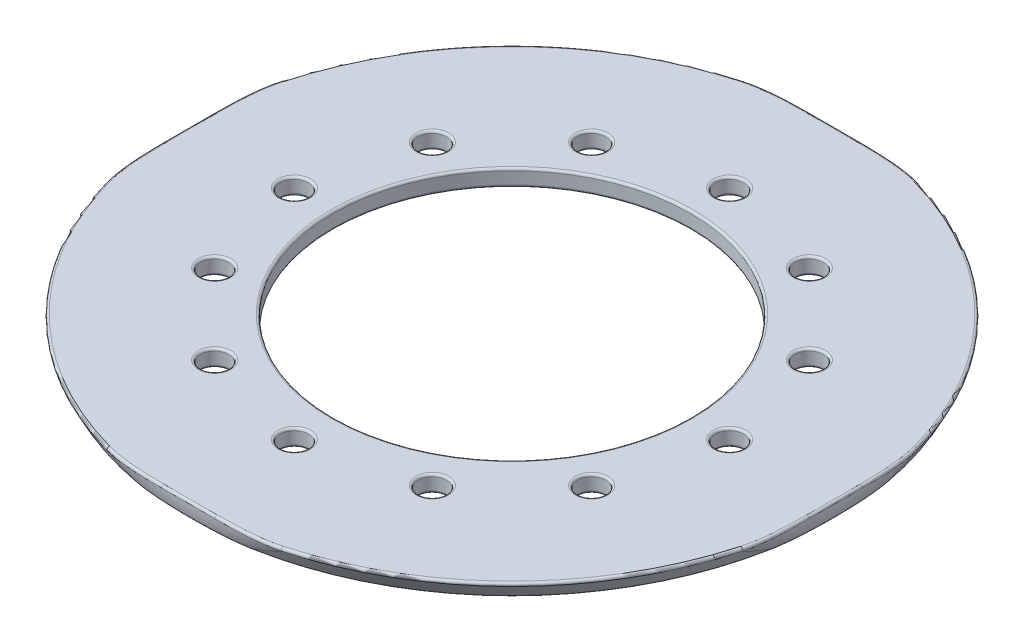
from build123d import *

# Parameters (mm, degrees)
TOP_CUT_DEPTH                    = 152.25
TOP_CUT_DEPTH_BACK               = 50
TOP_CUT_SKETCH_W                 = 443.917863005
TOP_CUT_SKETCH_H                 = 367.972648153
BOLT_HOLE_CUT_SKETCH_R           = 3.15625
BOLT_HOLE_CUT_DEPTH              = 143.297004536
BOLT_HOLE_CIRCULAR_PATTERN_COUNT = 12
SIDE_CUT_SKETCH_W                = 344.016473242
SIDE_CUT_SKETCH_H                = 145.993446884
SIDE_CUT_DEPTH                   = 191.395733114
CENTER_CUT_SKETCH_R              = 40
CENTER_CUT_DEPTH                 = 143.297004574
CIRPATTERN1_COUNT                = 4
BOTTOM_CUT_SKETCH_W              = 195
BOTTOM_CUT_SKETCH_H              = 195
BOTTOM_CUT_DEPTH                 = 32.154348448
FILLET1_R                        = 10
FILLET2_R                        = 0.5


with BuildPart() as part:
    # Main Revolve Sketch → Main Revolve (revolve)
    with BuildSketch(Plane.XY):
        with BuildLine():
            Line((0, 0), (0, 13.75))
            Line((0, 13.75), (0, 96.25))
            ThreePointArc((0, 96.25), (-58.336309448, 72.086309448), (-82.5, 13.75))
            Line((-82.5, 13.75), (-82.5, -13.75))
            ThreePointArc((-82.5, -13.75), (-58.336309448, -72.086309448), (0, -96.25))
            Line((0, -96.25), (0, -13.75))
            Line((0, -13.75), (0, 0))
        make_face()
    revolve(axis=Axis((0, 13.75, 0), (0, 1, 0)))

    # Top Cut Sketch → Top Cut (cut, two sides: drawn at the far end of the back side and taken through both)
    with BuildSketch(Plane(origin=(0, 0, 0), x_dir=(1, 0, 0), z_dir=(0, 1, 0)).offset(-TOP_CUT_DEPTH_BACK)):
        with Locations((35.712333175, -10.849316407)):
            Rectangle(TOP_CUT_SKETCH_W, TOP_CUT_SKETCH_H)
    extrude(amount=TOP_CUT_DEPTH + TOP_CUT_DEPTH_BACK, mode=Mode.SUBTRACT)

    # Bolt Hole Cut Sketch → Bolt Hole Cut (cut, symmetric)
    with BuildSketch(Plane(origin=(0, 0, 0), x_dir=(1, 0, 0), z_dir=(0, 1, 0))):
        with Locations(Location((-48.75, 0, 0), (0, 0, 270))):
            Circle(BOLT_HOLE_CUT_SKETCH_R)
    bolt_hole_cut = extrude(amount=BOLT_HOLE_CUT_DEPTH, both=True, mode=Mode.SUBTRACT)

    # Bolt Hole Circular Pattern: Bolt Hole Cut ×12 about axis
    bolt_hole_circular_pattern_axis = Axis((0, 0, 0), (0, 1, 0))
    for i in range(1, BOLT_HOLE_CIRCULAR_PATTERN_COUNT):
        add(bolt_hole_cut.rotate(bolt_hole_circular_pattern_axis, i * 360 / BOLT_HOLE_CIRCULAR_PATTERN_COUNT), mode=Mode.SUBTRACT)

    # Side Cut Sketch → Side Cut (cut, through all)
    with BuildSketch(Plane.XY.offset(72.5)):
        with Locations((-8.982819182, -61.331760594)):
            Rectangle(SIDE_CUT_SKETCH_W, SIDE_CUT_SKETCH_H)
    side_cut = extrude(amount=SIDE_CUT_DEPTH, mode=Mode.SUBTRACT)

    # Center Cut Sketch → Center Cut (cut, through all)
    with BuildSketch(Plane(origin=(0, 0, 0), x_dir=(1, 0, 0), z_dir=(0, 1, 0))):
        with Locations(Location((0, 0, 0), (0, 0, 270))):
            Circle(CENTER_CUT_SKETCH_R)
    extrude(amount=-CENTER_CUT_DEPTH, mode=Mode.SUBTRACT)

    # CirPattern1: Side Cut ×4 about axis
    cirpattern1_axis = Axis((0, 0, 0), (0, 1, 0))
    for i in range(1, CIRPATTERN1_COUNT):
        add(side_cut.rotate(cirpattern1_axis, i * 360 / CIRPATTERN1_COUNT), mode=Mode.SUBTRACT)

    # Bottom Cut Sketch → Bottom Cut (cut)
    with BuildSketch(Plane(origin=(0, -85.904348448, 0), x_dir=(-1, 0, 0), z_dir=(0, -1, 0))):
        Rectangle(BOTTOM_CUT_SKETCH_W, BOTTOM_CUT_SKETCH_H)
    extrude(amount=-BOTTOM_CUT_DEPTH, mode=Mode.SUBTRACT)

    # Fillet1
    # the kernel refuses this fillet: 10 mm, written as the material it takes off along each edge
    with BuildSketch(Plane(origin=(72.5, -13.75, 0), x_dir=(0, -0.8371149165543559, -0.5470270710688764), z_dir=(0, 0.5470270710688764, -0.8371149165543559))) as fillet1_piece_1:
        with BuildLine():
            CenterArc((36.742346142, 10), FILLET1_R, 270, 30.450314021)
            Line((36.742346142, 0), (39.37003937, 0))
            ThreePointArc((39.37003937, 0), (40.596006103, 0.679290671), (41.810255954, 1.379310345))
        make_face()
    revolve(axis=Axis((72.5, -13.75, 0), (-1, 0, 0)), revolution_arc=66.32659143, mode=Mode.SUBTRACT)
    with BuildSketch(Plane(origin=(-72.5, -13.75, 0), x_dir=(0, -0.8371225543218439, 0.5470153828236199), z_dir=(0, 0.5470153828236199, 0.8371225543218439))) as fillet1_piece_2:
        with BuildLine():
            CenterArc((36.742346142, 10), FILLET1_R, 270, 30.450314021)
            Line((36.742346142, 0), (39.37003937, 0))
            ThreePointArc((39.37003937, 0), (40.596006103, 0.679290671), (41.810255954, 1.379310345))
        make_face()
    revolve(axis=Axis((-72.5, -13.75, 0), (1, 0, 0)), revolution_arc=33.162495725, mode=Mode.SUBTRACT)
    with BuildSketch(Plane(origin=(0, -13.75, -72.5), x_dir=(-0.5470270710688764, -0.8371149165543559, 0), z_dir=(-0.8371149165543559, 0.5470270710688764, 0))) as fillet1_piece_3:
        with BuildLine():
            CenterArc((36.742346142, 10), FILLET1_R, 270, 30.450314021)
            Line((36.742346142, 0), (39.37003937, 0))
            ThreePointArc((39.37003937, 0), (40.596006103, 0.679290671), (41.810255954, 1.379310345))
        make_face()
    revolve(axis=Axis((0, -13.75, -72.5), (0, 0, 1)), revolution_arc=66.32659143, mode=Mode.SUBTRACT)
    with BuildSketch(Plane(origin=(0, -13.75, 72.5), x_dir=(0.5470270710688766, -0.8371149165543559, 0), z_dir=(0.8371149165543559, 0.5470270710688766, 0))) as fillet1_piece_4:
        with BuildLine():
            CenterArc((36.742346142, 10), FILLET1_R, 270, 30.450314021)
            Line((36.742346142, 0), (39.37003937, 0))
            ThreePointArc((39.37003937, 0), (40.596006103, 0.679290671), (41.810255954, 1.379310345))
        make_face()
    revolve(axis=Axis((0, -13.75, 72.5), (0, 0, -1)), revolution_arc=66.32659143, mode=Mode.SUBTRACT)
    with BuildSketch(Plane(origin=(-72.5, -13.75, 0), x_dir=(0, -1, 0), z_dir=(0, 0, 1))) as fillet1_piece_5:
        with BuildLine():
            CenterArc((36.742346142, 10), FILLET1_R, 270, 30.450314021)
            Line((36.742346142, 0), (39.37003937, 0))
            ThreePointArc((39.37003937, 0), (40.596006103, 0.679290671), (41.810255954, 1.379310345))
        make_face()
    revolve(axis=Axis((-72.5, -13.75, 0), (1, 0, 0)), revolution_arc=33.162495725, mode=Mode.SUBTRACT)

    # Fillet2
    fillet2_edges = [part.edges().sort_by_distance(p)[0] for p in [
        (0, -50, -40),
        (-48.75, -53.75, -3.15625),
        (-40.640613434, -53.75, -27.108392681),
        (3.15625, -53.75, -48.75),
        (43.796863434, -53.75, -21.641607319),
        (40.640613434, -53.75, 27.108392681),
        (-3.15625, -53.75, 48.75),
        (0, -53.75, -40),
        (-27.108392681, -53.75, 40.640613434),
        (21.641607319, -53.75, 43.796863434),
        (48.75, -53.75, 3.15625),
        (27.108392681, -53.75, -40.640613434),
        (-21.641607319, -53.75, -43.796863434),
        (-43.796863434, -53.75, 21.641607319),
        (51.02082908, -53.75, 51.02082908),
        (72.5, -50, 0),
        (72.5, -50.492346142, 0),
        (52.403184541, -50, 52.403184541),
        (52.403184541, -50, -52.403184541),
        (0, -50, -72.5),
        (-52.403184541, -50, -52.403184541),
        (-72.5, -50, 0),
        (-52.403184541, -50, 52.403184541),
        (0, -50, 72.5),
        (-13.467377168, -50, 72.31228654),
        (13.467377168, -50, 72.31228654),
        (-72.31228654, -50, -13.467377168),
        (-72.31228654, -50, 13.467377168),
        (13.467377168, -50, -72.31228654),
        (-13.467377168, -50, -72.31228654),
        (72.31228654, -50, 13.467377168),
        (72.31228654, -50, -13.467377168),
        (51.02082908, -53.75, -51.02082908),
        (-51.02082908, -53.75, -51.02082908),
        (-51.02082908, -53.75, 51.02082908),
        (0, -53.75, 71.954506403),
        (-71.954506404, -53.75, 0),
        (0, -53.75, -71.954506403),
        (71.954506403, -53.75, 0),
        (0, -50.492346142, -72.5),
        (-72.5, -50.492346142, 0),
        (0, -50.492346142, 72.5),
        (-48.75, -50, -3.15625),
        (-27.108392681, -50, 40.640613434),
        (-3.15625, -50, 48.75),
        (21.641607319, -50, 43.796863434),
        (40.640613434, -50, 27.108392681),
        (48.75, -50, 3.15625),
        (43.796863434, -50, -21.641607319),
        (27.108392681, -50, -40.640613434),
        (3.15625, -50, -48.75),
        (-21.641607319, -50, -43.796863434),
        (-40.640613434, -50, -27.108392681),
        (-43.796863434, -50, 21.641607319),
    ]]
    fillet(fillet2_edges, radius=FILLET2_R)


solid = part.part
